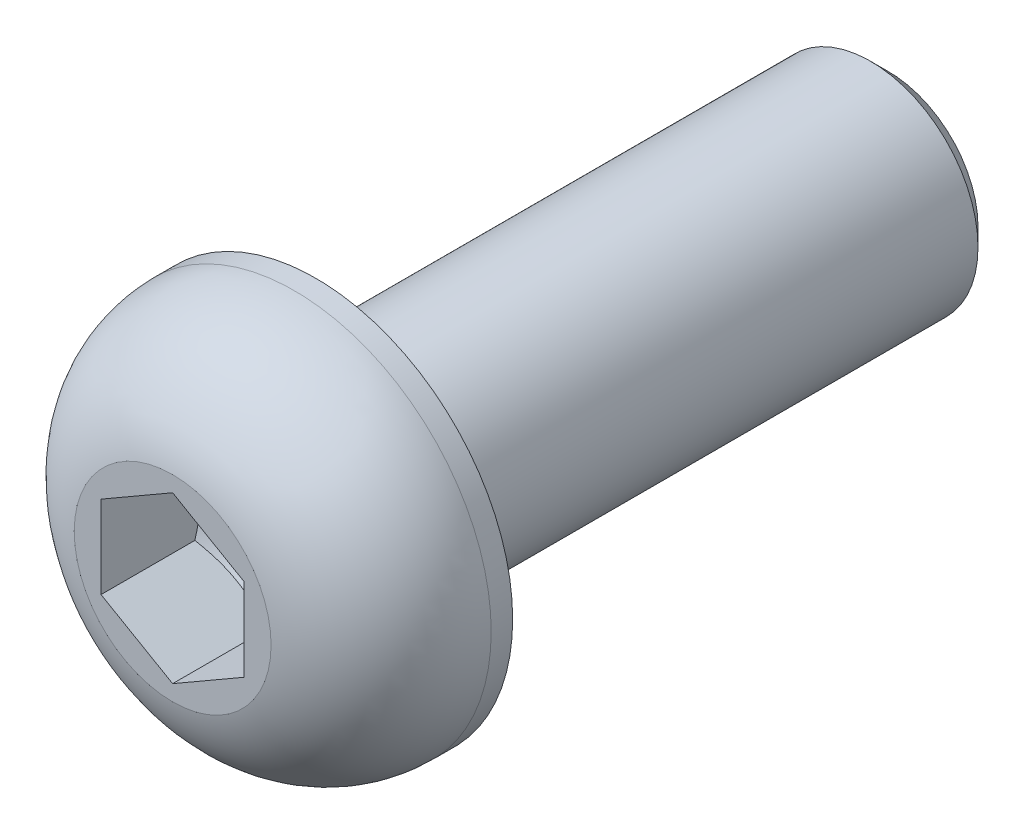
from build123d import *

# Parameters (mm, degrees)
CHAMFER1_SIZE      = 0.25
CUT_EXTRUDE1_REACH = 12.73


with BuildPart() as part:
    # Sketch2 → Revolve1 (revolve)
    with BuildSketch(Plane(origin=(0, 0, 0), x_dir=(0, 0, -1), z_dir=(1, 0, 0))):
        with BuildLine():
            Line((8, 0), (8, 1.5))
            Line((8, 1.5), (0, 1.5))
            Line((0, 1.5), (0, 2.75))
            Line((0, 2.75), (-0.3, 2.75))
            ThreePointArc((-0.3, 2.75), (-1.39323202, 2.363223225), (-2, 1.375))
            Line((-2, 1.375), (-2, 0))
            Line((-2, 0), (8, 0))
        make_face()
    revolve(axis=Axis((0, 0, 14.771903323), (0, 0, -1)))

    # Chamfer1
    chamfer1_edges = [part.edges().sort_by_distance(p)[0] for p in [
        (0, -1.5, -8),
    ]]
    chamfer(chamfer1_edges, length=CHAMFER1_SIZE)

    # Sketch3 → Cut-Revolve1 (revolve, cut)
    with BuildSketch(Plane(origin=(0, 0, 0), x_dir=(0, 0, -1), z_dir=(1, 0, 0))):
        Polygon((-2, 0), (-2, 1), (-0.6, 1), (-0.022649731, 0), align=None)
    revolve(axis=Axis((0, 0, 1.261909675), (0, 0, -1)), mode=Mode.SUBTRACT)

    # Cut-Extrude1: up to this cone (the profile starts inside it)
    cut_extrude1_end = Plane(origin=(0, 0, 2), z_dir=(0, 0, 1)).offset(-1.977349269) * Cone(1.732e-06, 32.271954122, 18.6322204, align=(Align.CENTER, Align.CENTER, Align.MIN), mode=Mode.PRIVATE)
    # Sketch4 → Cut-Extrude1 (cut, up to the surface)
    with BuildSketch(Plane.XY.offset(2), mode=Mode.PRIVATE) as cut_extrude1_sk1:
        Polygon((0, 1.154700538), (-1, 0.577350269), (-1, -0.577350269), (0, -1.154700538), (1, -0.577350269), (1, 0.577350269), align=None)
    cut_extrude1_tool1 = extrude(cut_extrude1_sk1.sketch, amount=-CUT_EXTRUDE1_REACH, mode=Mode.PRIVATE) & cut_extrude1_end
    add(cut_extrude1_tool1.solids().sort_by_distance((0, 0, 2))[0], mode=Mode.SUBTRACT)


solid = part.part
